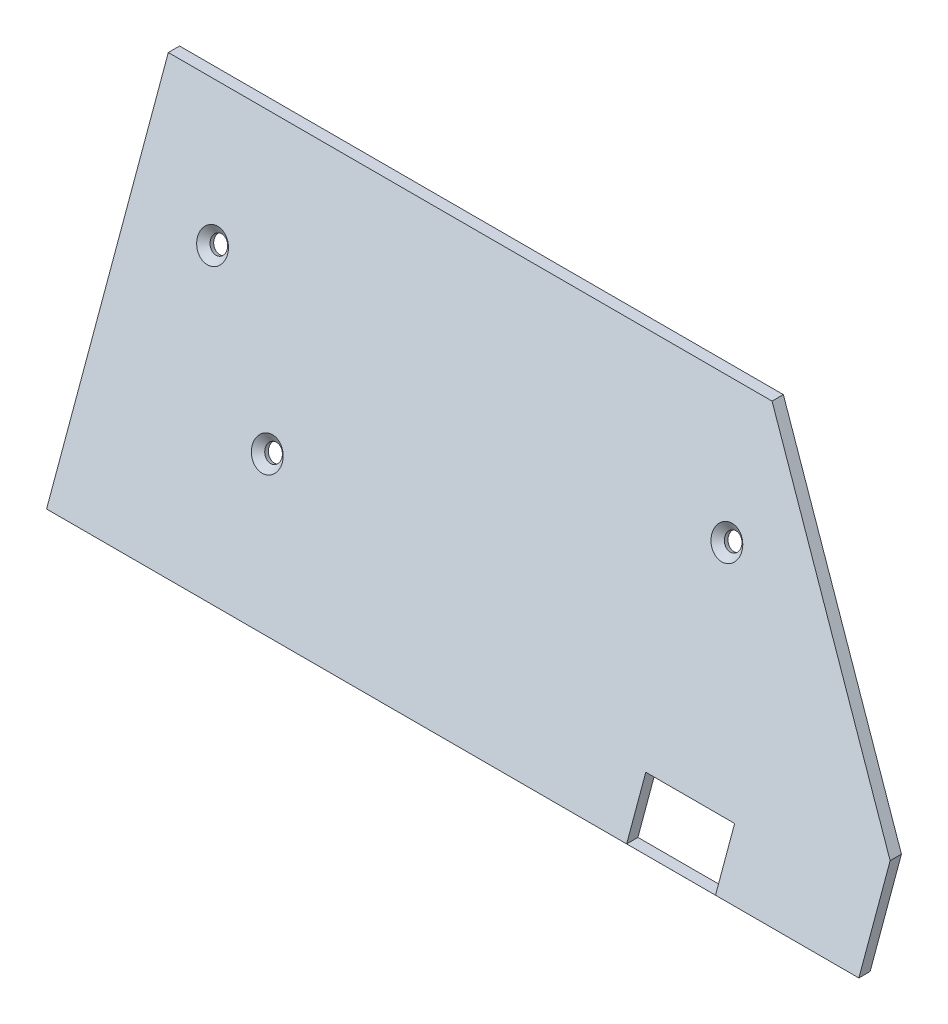
from build123d import *

# Parameters (mm, degrees)
MAIN_DEPTH                                      = 85
BACKBRACKETHOLES_D                              = 3.5
BACKBRACKETHOLES_DEPTH                          = 5
BACKBRACKETHOLES_CSINK_D                        = 6.3
BACKBRACKETHOLES_CSINK_ANGLE                    = 90
CUT_EXTRUDE1_DEPTH                              = 28.6
CSK_FOR_M3_FLAT_HEAD_MACHINE_SCREW1_D           = 3.5
CSK_FOR_M3_FLAT_HEAD_MACHINE_SCREW1_DEPTH       = 5
CSK_FOR_M3_FLAT_HEAD_MACHINE_SCREW1_CSINK_D     = 6.3
CSK_FOR_M3_FLAT_HEAD_MACHINE_SCREW1_CSINK_ANGLE = 90
CUT_EXTRUDE3_REACH                              = 145.023
CUT_EXTRUDE3_START                              = 30
SKETCH7_W                                       = 18.6
SKETCH7_H                                       = 11


with BuildPart() as part:
    # Sketch1 → Main (new, symmetric)
    with BuildSketch(Plane(origin=(0, 0, 0), x_dir=(0, 0, -1), z_dir=(1, 0, 0))):
        Polygon((0, 0), (-2.3622, 0), (23.115716399, 70), (25.477916399, 70), align=None)
    extrude(amount=MAIN_DEPTH, both=True)

    # BackBracketHoles
    with Locations(Plane(origin=(0, 0.759196446, 2.085875092), x_dir=(1, 0, 0), z_dir=(0, 0.3420201433256726, 0.9396926207859071))):
        with Locations((-67.6378, 50.002080017), (-47.6378, 25.002080017)):
            CounterSinkHole(BACKBRACKETHOLES_D / 2, BACKBRACKETHOLES_CSINK_D / 2, depth=BACKBRACKETHOLES_DEPTH, counter_sink_angle=BACKBRACKETHOLES_CSINK_ANGLE)

    # Sketch4 → Cut-Extrude1 (cut)
    with BuildSketch(Plane.XY):
        Polygon((41.356687338, 70), (100, 0.111621453), (100, 70), align=None)
    extrude(amount=-CUT_EXTRUDE1_DEPTH, mode=Mode.SUBTRACT)

    # CSK for M3 Flat Head Machine Screw1
    with Locations(Plane(origin=(0, 0.759196446, 2.085875092), x_dir=(1, 0, 0), z_dir=(0, 0.3420201433256726, 0.9396926207859071))):
        with Locations((40, 50.002080017)):
            CounterSinkHole(CSK_FOR_M3_FLAT_HEAD_MACHINE_SCREW1_D / 2, CSK_FOR_M3_FLAT_HEAD_MACHINE_SCREW1_CSINK_D / 2, depth=CSK_FOR_M3_FLAT_HEAD_MACHINE_SCREW1_DEPTH, counter_sink_angle=CSK_FOR_M3_FLAT_HEAD_MACHINE_SCREW1_CSINK_ANGLE)

    # Cut-Extrude3: up to this plane
    cut_extrude3_end = Plane(origin=(85, 70, -25.477916399), z_dir=(0, 0.3420201433256726, 0.939692620785907))
    # Sketch7 → Cut-Extrude3 (cut, up to the surface)
    with BuildSketch(Plane.XY.offset(CUT_EXTRUDE3_START), mode=Mode.PRIVATE) as cut_extrude3_sk1:
        with Locations((45.7, 5.501954577)):
            Rectangle(SKETCH7_W, SKETCH7_H)
    cut_extrude3_tool1 = split(extrude(cut_extrude3_sk1.sketch, amount=-CUT_EXTRUDE3_REACH, mode=Mode.PRIVATE), bisect_by=cut_extrude3_end, keep=Keep.BOTH, mode=Mode.PRIVATE)
    add(cut_extrude3_tool1.solids().sort_by_distance((45.7, 5.501955, 30))[0], mode=Mode.SUBTRACT)


solid = part.part
